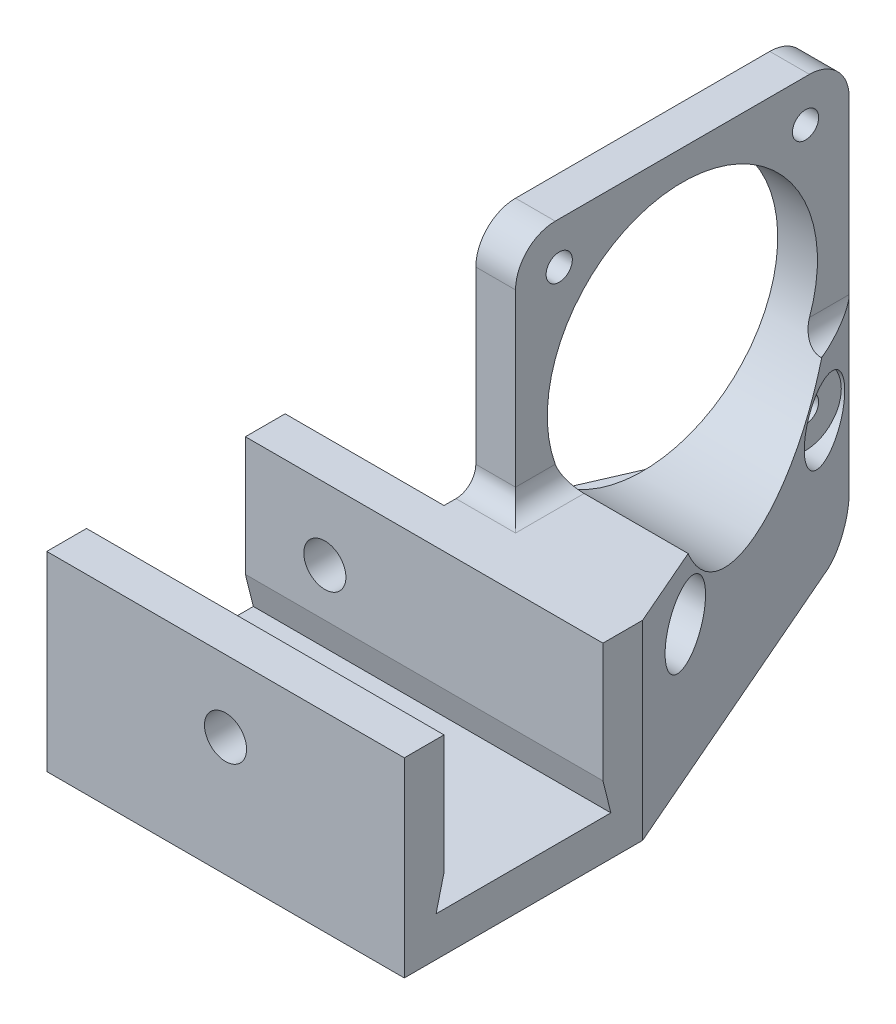
from build123d import *

# Parameters (mm, degrees)
SKETCH1_W               = 45
SKETCH1_H               = 24
BOSS_EXTRUDE1_DEPTH     = 5
SKETCH2_W               = 5
SKETCH2_H               = 24
BOSS_EXTRUDE2_DEPTH     = 46
SKETCH3_W               = 45
SKETCH3_H               = 5
BOSS_EXTRUDE3_DEPTH     = 20
CHAMFER2_SIZE           = 45.996850945
CHAMFER2_SIZE_2         = 20
CHAMFER3_SIZE2          = 45.996850945
CHAMFER3_SIZE           = 20
SKETCH4_W               = 5
SKETCH4_H               = 42
BOSS_EXTRUDE4_DEPTH     = 29
CUT_EXTRUDE1_DEPTH      = 75.498322129
CUT_EXTRUDE1_DEPTH_BACK = 75.498322129
SKETCH6_R               = 17
SKETCH7_W               = 46
SKETCH7_H               = 44
CUT_EXTRUDE2_DEPTH      = 75.498322129
SKETCH8_R               = 1.65
CUT_EXTRUDE3_DEPTH      = 75.498322129
SKETCH9_R               = 4.5
CUT_EXTRUDE4_DEPTH      = 75.498322129
FILLET1_R               = 5
SKETCH10_R              = 2.65
CUT_EXTRUDE5_DEPTH      = 10
SKETCH11_R              = 2.65
CUT_EXTRUDE6_DEPTH      = 10
SKETCH12_W              = 45
SKETCH12_H              = 5
BOSS_EXTRUDE5_DEPTH     = 24
SKETCH13_R              = 2.65
CUT_EXTRUDE7_DEPTH      = 10
CUT_EXTRUDE8_DEPTH      = 84.366660003
CUT_EXTRUDE8_DEPTH_BACK = 84.366660003
FILLET2_R               = 2.5


# Some blends are built 0.0001 mm under size
with BuildPart() as part:
    # Sketch1 → Boss-Extrude1 (new body)
    with BuildSketch(Plane.XY):
        with Locations((22.5, 12)):
            Rectangle(SKETCH1_W, SKETCH1_H)
    extrude(amount=BOSS_EXTRUDE1_DEPTH)

    # Sketch2 → Boss-Extrude2 (add)
    with BuildSketch(Plane(origin=(0, 0, 0), x_dir=(-1, 0, 0), z_dir=(0, 0, -1))):
        with Locations((-22.5, 12)):
            Rectangle(SKETCH2_W, SKETCH2_H)
    extrude(amount=BOSS_EXTRUDE2_DEPTH)

    # Sketch3 → Boss-Extrude3 (add)
    with BuildSketch(Plane.XY.offset(5)):
        with Locations((22.5, 2.5)):
            Rectangle(SKETCH3_W, SKETCH3_H)
    extrude(amount=BOSS_EXTRUDE3_DEPTH)

    # Chamfer2
    # the kernel refuses this chamfer: 45.996850945, 20 mm, written as the material it adds along each edge
    with BuildSketch(Plane(origin=(25, 0, 0), x_dir=(-0.015383761930769691, 0, -0.9998816629325978), z_dir=(0, 1, 0))) as chamfer2_piece_1_section:
        Polygon((CHAMFER2_SIZE * 0.999881662927, -CHAMFER2_SIZE * 0.0153837619307), (-CHAMFER2_SIZE_2 * 0.0153837619308, -CHAMFER2_SIZE_2 * 0.999881662933), (0, 0), align=None)
    chamfer2_piece_1 = extrude(amount=24, mode=Mode.PRIVATE)
    chamfer2_piece_1 = split(chamfer2_piece_1, bisect_by=Plane(origin=(45, 12, -15.645189054), z_dir=(-1, 0, 0)), keep=Keep.TOP, mode=Mode.PRIVATE)
    add(chamfer2_piece_1)

    # Chamfer3
    chamfer3_edges = [part.edges().sort_by_distance(p)[0] for p in [
        (20, 12, 0),
    ]]
    chamfer3_side = [part.faces().sort_by_distance(p)[0] for p in [
        (19.6, 12, 0),
    ]]
    chamfer(chamfer3_edges, length=CHAMFER3_SIZE - 0.0001, length2=CHAMFER3_SIZE2 - 0.0001, reference=chamfer3_side[0])  # a hair under: the kernel refuses the full size

    # Sketch4 → Boss-Extrude4 (add)
    with BuildSketch(Plane(origin=(0, 24, 0), x_dir=(1, 0, 0), z_dir=(0, 1, 0))):
        with Locations((22.5, 25)):
            Rectangle(SKETCH4_W, SKETCH4_H)
    extrude(amount=BOSS_EXTRUDE4_DEPTH)

    # Sketch6 → Cut-Extrude1 (cut, two sides: drawn at the far end of the back side and taken through both)
    with BuildSketch(Plane(origin=(25, 0, 0), x_dir=(0, 0, -1), z_dir=(1, 0, 0)).offset(-CUT_EXTRUDE1_DEPTH_BACK)):
        with Locations(Location((25, 32.24, 0), (0, 0, 331.00679558))):
            Circle(SKETCH6_R)
    extrude(amount=CUT_EXTRUDE1_DEPTH + CUT_EXTRUDE1_DEPTH_BACK, mode=Mode.SUBTRACT)

    # Sketch7 → Cut-Extrude2 (cut, through all)
    with BuildSketch(Plane.ZY.offset(-20)):
        with Locations((-23, 31)):
            Rectangle(SKETCH7_W, SKETCH7_H)
    extrude(amount=CUT_EXTRUDE2_DEPTH, mode=Mode.SUBTRACT)

    # Sketch8 → Cut-Extrude3 (cut, through all)
    with BuildSketch(Plane.ZY.offset(-20)):
        with Locations(Location((-40.5, 47.74, 0), (0, 0, 270))):
            Circle(SKETCH8_R)
        with Locations(Location((-9.5, 47.74, 0), (0, 0, 270))):
            Circle(SKETCH8_R)
        with Locations(Location((-9.5, 16.74, 0), (0, 0, 270))):
            Circle(SKETCH8_R)
        with Locations(Location((-40.5, 16.74, 0), (0, 0, 270))):
            Circle(SKETCH8_R)
    extrude(amount=-CUT_EXTRUDE3_DEPTH, mode=Mode.SUBTRACT)

    # Sketch9 → Cut-Extrude4 (cut, through all)
    with BuildSketch(Plane(origin=(25, 0, 0), x_dir=(0, 0, -1), z_dir=(1, 0, 0))):
        with Locations((9.5, 16.74)):
            Circle(SKETCH9_R)
        with Locations((40.5, 16.74)):
            Circle(SKETCH9_R)
    extrude(amount=CUT_EXTRUDE4_DEPTH, mode=Mode.SUBTRACT)

    # Fillet1
    fillet1_edges = [part.edges().sort_by_distance(p)[0] for p in [
        (22.5, 0, -46),
        (22.5, 53, -4),
        (22.5, 53, -46),
    ]]
    fillet(fillet1_edges, radius=FILLET1_R)

    # Sketch10 → Cut-Extrude5 (cut)
    with BuildSketch(Plane.XZ):
        with Locations(Location((22.5, 15, 0), (0, 0, 270))):
            Circle(SKETCH10_R)
    extrude(amount=-CUT_EXTRUDE5_DEPTH, mode=Mode.SUBTRACT)

    # Sketch11 → Cut-Extrude6 (cut)
    with BuildSketch(Plane.XY.offset(5)):
        with Locations((10, 15)):
            Circle(SKETCH11_R)
    extrude(amount=-CUT_EXTRUDE6_DEPTH, mode=Mode.SUBTRACT)

    # Sketch12 → Boss-Extrude5 (add)
    with BuildSketch(Plane(origin=(0, 0, 0), x_dir=(1, 0, 0), z_dir=(0, 1, 0))):
        with Locations((22.5, -27.5)):
            Rectangle(SKETCH12_W, SKETCH12_H)
    extrude(amount=BOSS_EXTRUDE5_DEPTH)

    # Sketch13 → Cut-Extrude7 (cut)
    with BuildSketch(Plane.XY.offset(30)):
        with Locations((22.5, 15)):
            Circle(SKETCH13_R)
    extrude(amount=-CUT_EXTRUDE7_DEPTH, mode=Mode.SUBTRACT)

    # Sketch14 → Cut-Extrude8 (cut, two sides: drawn at the far end of the back side and taken through both)
    with BuildSketch(Plane(origin=(45, 0, 0), x_dir=(0, 0, -1), z_dir=(1, 0, 0)).offset(-CUT_EXTRUDE8_DEPTH_BACK)):
        Polygon((-25, 5), (-26, 5), (-25, 9), align=None)
        Polygon((-5, 5), (-4, 5), (-5, 9), align=None)
    extrude(amount=CUT_EXTRUDE8_DEPTH + CUT_EXTRUDE8_DEPTH_BACK, mode=Mode.SUBTRACT)

    # Fillet2
    # the kernel refuses this fillet: 2.5 mm, written as the material it adds along each edge
    with BuildSketch(Plane(origin=(25, 24, -4), x_dir=(0, 0, 1), z_dir=(-1, 0, 0))) as fillet2_piece_1:
        with BuildLine():
            CenterArc((FILLET2_R, FILLET2_R), FILLET2_R, 180, 90)
            Line((0, FILLET2_R), (0, 0))
            Line((0, 0), (FILLET2_R, 0))
        make_face()
    extrude(amount=5)
    with BuildSketch(Plane(origin=(25, 24, -16.380487567), x_dir=(1, 0, 0), z_dir=(0, 0, 1))) as fillet2_piece_2_section:
        with BuildLine():
            CenterArc((FILLET2_R, FILLET2_R), FILLET2_R, 180, 90)
            Line((0, FILLET2_R), (0, 0))
            Line((0, 0), (FILLET2_R, 0))
        make_face()
    fillet2_piece_2 = extrude(amount=12.380487567, mode=Mode.PRIVATE)
    fillet2_piece_2 = fillet2_piece_2 - Plane(origin=(25.580464588, 32.24, -25), x_dir=(0, -0.48470588235146506, -0.8746772019516044), z_dir=(1, 0, 0)) * Cylinder(17, 35, mode=Mode.PRIVATE)
    add(fillet2_piece_2)
    with BuildSketch(Plane(origin=(25, 24, -52.246850945), x_dir=(0, 1, 0), z_dir=(0, 0, 1))) as fillet2_piece_3_section:
        with BuildLine():
            CenterArc((FILLET2_R, -FILLET2_R), FILLET2_R, 90, 90)
            Line((0, -FILLET2_R), (0, 0))
            Line((0, 0), (FILLET2_R, 0))
        make_face()
    fillet2_piece_3 = extrude(amount=18.627338512, mode=Mode.PRIVATE)
    fillet2_piece_3 = split(fillet2_piece_3, bisect_by=Plane(origin=(25.437853411, 24.621520757, -46), z_dir=(0, 0, 1)), keep=Keep.TOP, mode=Mode.PRIVATE)
    fillet2_piece_3 = split(fillet2_piece_3, bisect_by=Plane(origin=(26.31729653, 24.621520757, -42.967276338), z_dir=(-0.9170600743850381, 0, 0.398749068925444)), keep=Keep.TOP, mode=Mode.PRIVATE)
    fillet2_piece_3 = fillet2_piece_3 - Plane(origin=(25.437853411, 32.24, -25), x_dir=(0, -0.48470588235146506, -0.8746772019516044), z_dir=(1, 0, 0)) * Cylinder(17, 48, mode=Mode.PRIVATE)
    add(fillet2_piece_3)
    with BuildSketch(Plane(origin=(25, 24, -16.380487567), x_dir=(1, 0, 0), z_dir=(0, 0, 1))) as fillet2_piece_4a_section:
        with BuildLine():
            CenterArc((FILLET2_R, FILLET2_R), FILLET2_R, 180, 90)
            Line((0, FILLET2_R), (0, 0))
            Line((0, 0), (FILLET2_R, 0))
        make_face()
    fillet2_piece_4a = extrude(amount=18.630487567, mode=Mode.PRIVATE)
    fillet2_piece_4a = split(fillet2_piece_4a, bisect_by=Plane(origin=(25.565987786, 24.565987786, -4), z_dir=(0, 0, 1)), keep=Keep.TOP, mode=Mode.PRIVATE)
    with BuildSketch(Plane(origin=(31.25, 24, -4), x_dir=(0, 0, 1), z_dir=(-1, 0, 0))) as fillet2_piece_4b_section:
        with BuildLine():
            CenterArc((FILLET2_R, FILLET2_R), FILLET2_R, 180, 90)
            Line((0, FILLET2_R), (0, 0))
            Line((0, 0), (FILLET2_R, 0))
        make_face()
    fillet2_piece_4b = extrude(amount=11.25, mode=Mode.PRIVATE)
    fillet2_piece_4b = split(fillet2_piece_4b, bisect_by=Plane(origin=(25, 24.565987786, -3.434012214), z_dir=(1, 0, 0)), keep=Keep.TOP, mode=Mode.PRIVATE)
    fillet2_piece_4 = fillet2_piece_4a & fillet2_piece_4b
    add(fillet2_piece_4)


solid = part.part
